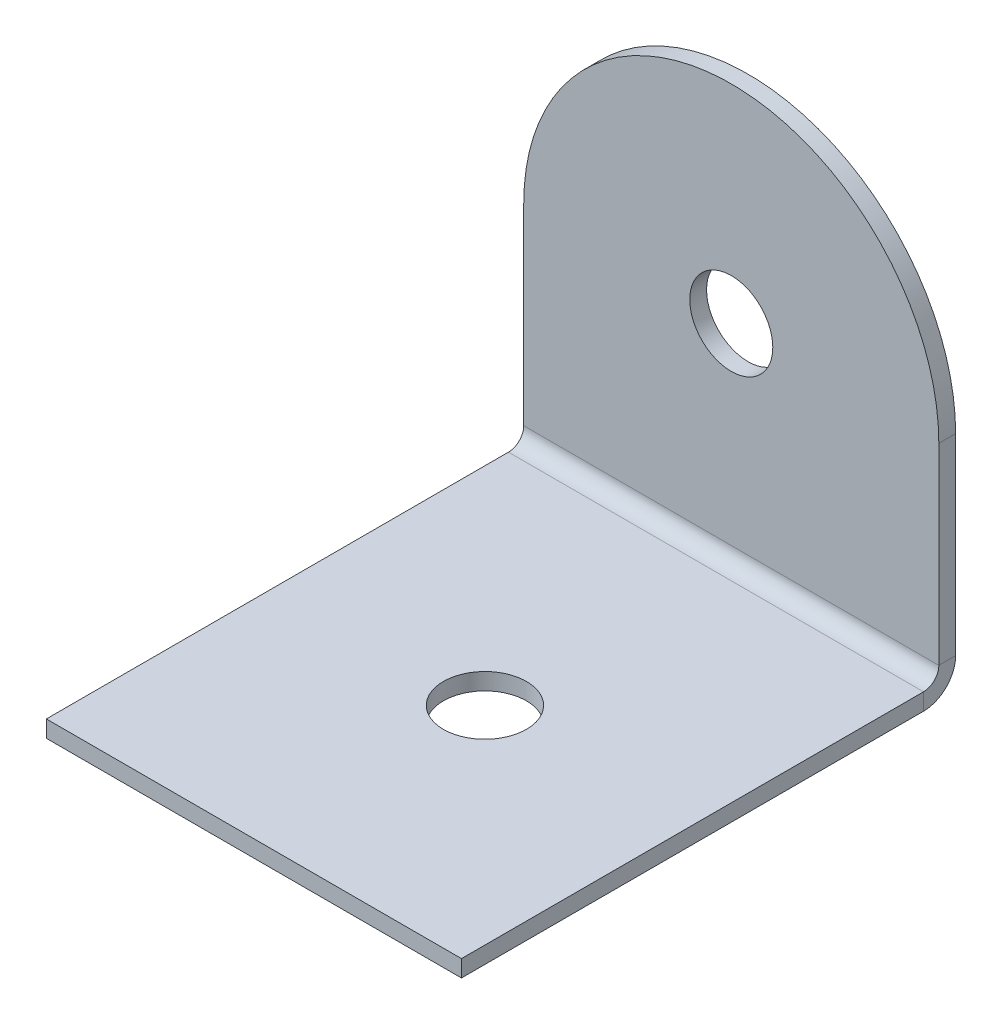
from build123d import *

# Parameters (mm, degrees)
BASE_FLANGE1_DEPTH           = 0.81
EDGE_FLANGE1_STRIP_W         = 4.7132
EDGE_FLANGE1_STRIP_H         = 0.81
EDGE_FLANGE1_STRIP_CUT_DEPTH = 20
EDGE_FLANGE1_DEPTH           = 20
CUT_EXTRUDE1_REACH           = 38.455
SKETCH9_R                    = 2
CUT_EXTRUDE2_REACH           = 38.455
SKETCH10_R                   = 2


# Sheet-metal steps are written as plain solids
with BuildPart() as part:
    # Sketch1 → Base-Flange1 (new body)
    with BuildSketch(Plane.XY):
        with BuildLine():
            Line((0, 0), (20, 0))
            Line((20, 0), (20, 10))
            ThreePointArc((20, 10), (10, 20), (0, 10))
            Line((0, 10), (0, 0))
        make_face()
    extrude(amount=-BASE_FLANGE1_DEPTH)

    # Edge-Flange1 strip (across the edge) → Edge-Flange1 strip cut (cut)
    with BuildSketch(Plane.YZ):
        with Locations((-1.62, -0.405)):
            Rectangle(EDGE_FLANGE1_STRIP_W, EDGE_FLANGE1_STRIP_H)
    extrude(amount=EDGE_FLANGE1_STRIP_CUT_DEPTH, mode=Mode.SUBTRACT)

    # Edge-Flange1 section (across the edge) → Edge-Flange1 (add)
    with BuildSketch(Plane.YZ):
        with BuildLine():
            Line((-0.81, 0.7366), (-0.81, 23))
            Line((-0.81, 23), (0, 23))
            Line((0, 23), (0, 0.7366))
            ThreePointArc((0, 0.7366), (0.215745145, 0.215745145), (0.7366, 0))
            Line((0.7366, 0), (0.7366, -0.81))
            ThreePointArc((0.7366, -0.81), (-0.357011348, -0.357011348), (-0.81, 0.7366))
        make_face()
    extrude(amount=EDGE_FLANGE1_DEPTH)

    # Sketch9 → Cut-Extrude1 (cut, up to next)
    with BuildSketch(Plane.XY, mode=Mode.PRIVATE) as cut_extrude1_sk1:
        with Locations((10, 10)):
            Circle(SKETCH9_R)
    cut_extrude1_tool1 = extrude(cut_extrude1_sk1.sketch, amount=-CUT_EXTRUDE1_REACH, mode=Mode.PRIVATE) & part.part
    add(cut_extrude1_tool1.solids().sort_by_distance((10, 10, 0))[0], mode=Mode.SUBTRACT)

    # Sketch10 → Cut-Extrude2 (cut, up to next)
    with BuildSketch(Plane(origin=(0, 0, 0), x_dir=(1, 0, 0), z_dir=(0, 1, 0)), mode=Mode.PRIVATE) as cut_extrude2_sk1:
        with Locations(Location((10, -11.87, 0), (0, 0, 270))):
            Circle(SKETCH10_R)
    cut_extrude2_tool1 = extrude(cut_extrude2_sk1.sketch, amount=-CUT_EXTRUDE2_REACH, mode=Mode.PRIVATE) & part.part
    add(cut_extrude2_tool1.solids().sort_by_distance((10, 0, 11.87))[0], mode=Mode.SUBTRACT)


solid = part.part
